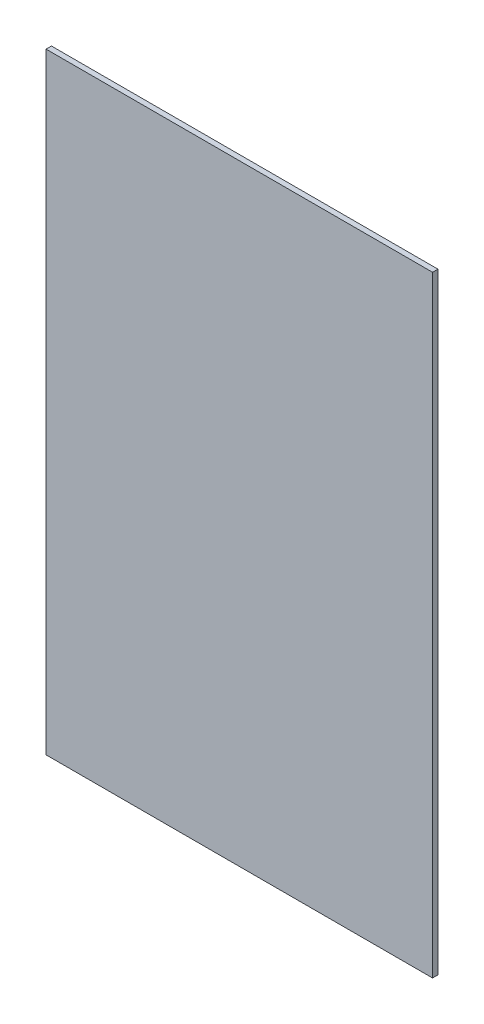
from build123d import *

# Parameters (mm, degrees)
SKETCH1_W          = 215
SKETCH1_H          = 340
BASE_FLANGE1_DEPTH = 3


# Sheet-metal steps are written as plain solids
with BuildPart() as part:
    # Sketch1 → Base-Flange1 (new body)
    with BuildSketch(Plane(origin=(0, 0, -122.5), x_dir=(-1, 0, 0), z_dir=(0, 0, -1))):
        with Locations((0, 160)):
            Rectangle(SKETCH1_W, SKETCH1_H)
    extrude(amount=BASE_FLANGE1_DEPTH)


solid = part.part
